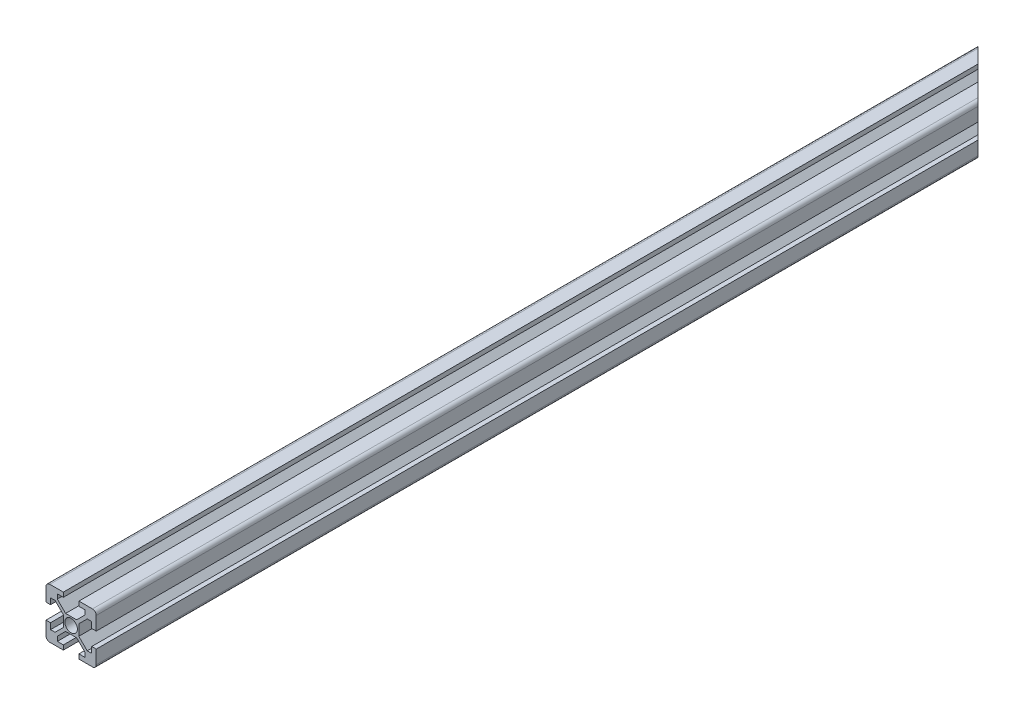
from build123d import *

# Parameters (mm, degrees)
SKETCH_1_R          = 2.5
EXTRUDE_1_DEPTH     = 371
CUT_EXTRUDE_1_DEPTH = 372.673243589


with BuildPart() as part:
    # 草图1 → 凸台-拉伸1 (new body)
    with BuildSketch(Plane.XY):
        with BuildLine():
            Line((-8.2, -3.1), (-10, -3.1))
            Line((-10, -3.1), (-10, -8.5))
            ThreePointArc((-10, -8.5), (-9.560660172, -9.560660172), (-8.5, -10))
            Line((-8.5, -10), (-3.1, -10))
            Line((-3.1, -10), (-3.1, -8.2))
            Line((-3.1, -8.2), (-5.5, -8.2))
            Line((-5.5, -8.2), (-5.5, -6.397050155))
            Line((-5.5, -6.397050155), (-2.202949845, -3.1))
            Line((-2.202949845, -3.1), (2.202949845, -3.1))
            Line((2.202949845, -3.1), (5.5, -6.397050155))
            Line((5.5, -6.397050155), (5.5, -8.2))
            Line((5.5, -8.2), (3.1, -8.2))
            Line((3.1, -8.2), (3.1, -10))
            Line((3.1, -10), (8.5, -10))
            ThreePointArc((8.5, -10), (9.560660172, -9.560660172), (10, -8.5))
            Line((10, -8.5), (10, -3.1))
            Line((10, -3.1), (8.2, -3.1))
            Line((8.2, -3.1), (8.2, -5.5))
            Line((8.2, -5.5), (6.397050155, -5.5))
            Line((6.397050155, -5.5), (3.05412702, -2.157076865))
            Line((3.05412702, -2.157076865), (3.05412702, 2.157076865))
            Line((3.05412702, 2.157076865), (6.397050155, 5.5))
            Line((6.397050155, 5.5), (8.2, 5.5))
            Line((8.2, 5.5), (8.2, 3.1))
            Line((8.2, 3.1), (10, 3.1))
            Line((10, 3.1), (10, 8.5))
            ThreePointArc((10, 8.5), (9.560660172, 9.560660172), (8.5, 10))
            Line((8.5, 10), (3.1, 10))
            Line((3.1, 10), (3.1, 8.2))
            Line((3.1, 8.2), (5.5, 8.2))
            Line((5.5, 8.2), (5.5, 6.397050155))
            Line((5.5, 6.397050155), (2.202949845, 3.1))
            Line((2.202949845, 3.1), (-2.202949845, 3.1))
            Line((-2.202949845, 3.1), (-5.5, 6.397050155))
            Line((-5.5, 6.397050155), (-5.5, 8.2))
            Line((-5.5, 8.2), (-3.1, 8.2))
            Line((-3.1, 8.2), (-3.1, 10))
            Line((-3.1, 10), (-8.5, 10))
            ThreePointArc((-8.5, 10), (-9.560660172, 9.560660172), (-10, 8.5))
            Line((-10, 8.5), (-10, 3.1))
            Line((-10, 3.1), (-8.2, 3.1))
            Line((-8.2, 3.1), (-8.2, 5.5))
            Line((-8.2, 5.5), (-6.397050155, 5.5))
            Line((-6.397050155, 5.5), (-3.05412702, 2.157076865))
            Line((-3.05412702, 2.157076865), (-3.05412702, -2.157076865))
            Line((-3.05412702, -2.157076865), (-6.397050155, -5.5))
            Line((-6.397050155, -5.5), (-8.2, -5.5))
            Line((-8.2, -5.5), (-8.2, -3.1))
        make_face()
        Circle(SKETCH_1_R, mode=Mode.SUBTRACT)
    extrude(amount=EXTRUDE_1_DEPTH)

    # 草图2 → 切除-拉伸1 (cut, through all)
    with BuildSketch(Plane(origin=(0, 10, 0), x_dir=(1, 0, 0), z_dir=(0, 1, 0))):
        Polygon((10, 0), (10, -20), (-10, 0), align=None)
    extrude(amount=-CUT_EXTRUDE_1_DEPTH, mode=Mode.SUBTRACT)


solid = part.part
